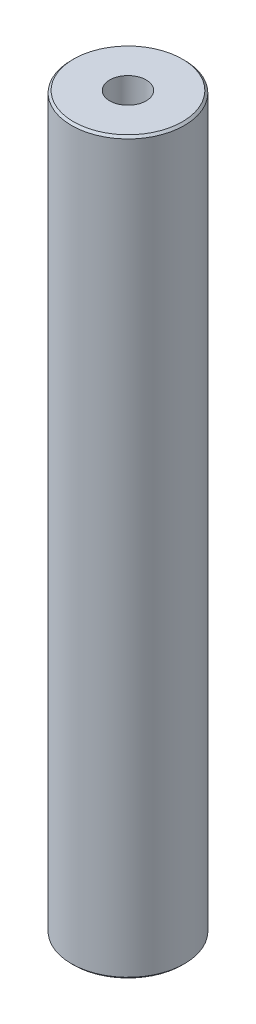
from build123d import *

# Parameters (mm, degrees)
SKETCH1_R           = 37.5
BOSS_EXTRUDE1_DEPTH = 484.642296782
SKETCH2_R           = 12.082664995
CUT_EXTRUDE1_DEPTH  = 488.535286753
CHAMFER1_SIZE       = 1.409572435


with BuildPart() as part:
    # Sketch1 → Boss-Extrude1 (new body)
    with BuildSketch(Plane(origin=(0, 0, 0), x_dir=(1, 0, 0), z_dir=(0, 1, 0))):
        Circle(SKETCH1_R)
    extrude(amount=BOSS_EXTRUDE1_DEPTH)

    # Sketch2 → Cut-Extrude1 (cut, through all)
    with BuildSketch(Plane(origin=(0, 0, 0), x_dir=(1, 0, 0), z_dir=(0, 1, 0))):
        Circle(SKETCH2_R)
    extrude(amount=CUT_EXTRUDE1_DEPTH, mode=Mode.SUBTRACT)

    # Chamfer1
    chamfer1_edges = [part.edges().sort_by_distance(p)[0] for p in [
        (-37.5, 484.642296782, 0),
        (-37.5, 0, 0),
    ]]
    chamfer(chamfer1_edges, length=CHAMFER1_SIZE)


solid = part.part
